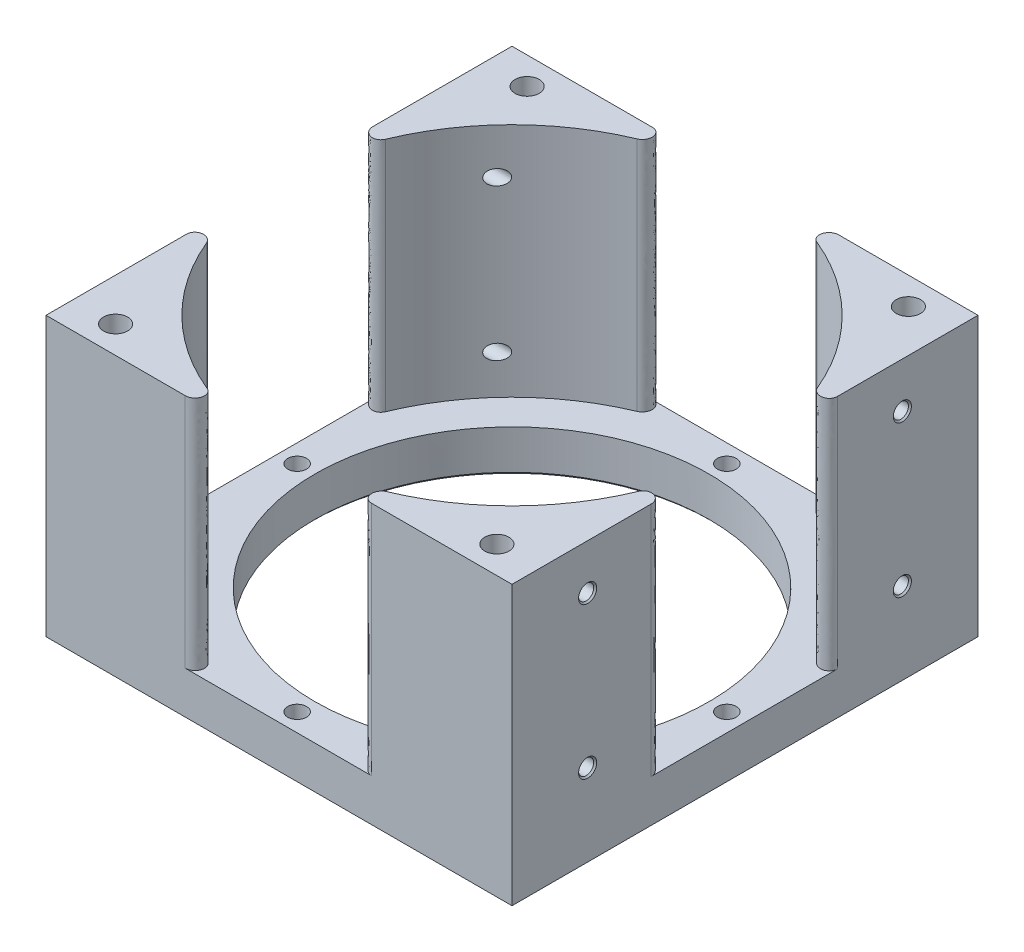
from build123d import *

# Parameters (mm, degrees)
SKIZZE1_W                                 = 77
SKIZZE1_H                                 = 77
AUFSATZ_LINEAR_AUSTRAGEN1_DEPTH           = 7
AUFSATZ_LINEAR_AUSTRAGEN2_DEPTH           = 39
SKIZZE3_R                                 = 32.575
SCHNITT_LINEAR_AUSTRAGEN1_DEPTH           = 67.973875677
F_3_1_3_1_DURCHMESSER_BOHRUNG1_D          = 3.1
F_2_5_2_5_DURCHMESSER_BOHRUNG1_AT_2_COUNT = 2
F_2_5_2_5_DURCHMESSER_BOHRUNG1_AT_2_PITCH = 52
F_2_5_2_5_DURCHMESSER_BOHRUNG1_AT_3_COUNT = 2
F_2_5_2_5_DURCHMESSER_BOHRUNG1_AT_3_PITCH = 57.697486947
F_2_5_2_5_DURCHMESSER_BOHRUNG1_AT_4_COUNT = 2
F_2_5_2_5_DURCHMESSER_BOHRUNG1_AT_4_PITCH = 25
SKIZZE8_R                                 = 2
SCHNITT_LINEAR_AUSTRAGEN2_DEPTH           = 72.277626331
FASE1_SIZE                                = 0.5


with BuildPart() as part:
    # Skizze1 → Aufsatz-Linear austragen1 (new body)
    with BuildSketch(Plane(origin=(0, 0, 0), x_dir=(1, 0, 0), z_dir=(0, 1, 0))):
        Rectangle(SKIZZE1_W, SKIZZE1_H)
    extrude(amount=AUFSATZ_LINEAR_AUSTRAGEN1_DEPTH)

    # Skizze2 → Aufsatz-Linear austragen2 (add)
    with BuildSketch(Plane(origin=(0, 7, 0), x_dir=(1, 0, 0), z_dir=(0, 1, 0))):
        with BuildLine():
            Line((2.404293035, 38.5), (38.5, 38.5))
            Line((38.5, 38.5), (38.5, 2.404293035))
            ThreePointArc((38.5, 2.404293035), (27.276644084, 27.276644084), (2.404293035, 38.5))
        make_face()
        with BuildLine():
            Line((-38.5, -38.5), (-2.404293035, -38.5))
            ThreePointArc((-2.404293035, -38.5), (-27.276644084, -27.276644084), (-38.5, -2.404293035))
            Line((-38.5, -2.404293035), (-38.5, -38.5))
        make_face()
        with BuildLine():
            Line((-38.5, 38.5), (-2.404293035, 38.5))
            ThreePointArc((-2.404293035, 38.5), (-27.276644084, 27.276644084), (-38.5, 2.404293035))
            Line((-38.5, 2.404293035), (-38.5, 38.5))
        make_face()
        with BuildLine():
            Line((38.5, -38.5), (38.5, -2.404293035))
            ThreePointArc((38.5, -2.404293035), (27.276644084, -27.276644084), (2.404293035, -38.5))
            Line((2.404293035, -38.5), (38.5, -38.5))
        make_face()
    extrude(amount=AUFSATZ_LINEAR_AUSTRAGEN2_DEPTH)

    # Verrundung1
    # a fillet whose section is not a circle: 2, 1 mm, written as the material it takes off along each edge
    with BuildSketch(Plane(origin=(38.5, 7, 2.404293035), x_dir=(0, 0, 1), z_dir=(0, 1, 0)), Plane(origin=(2.404293035, 7, -38.5), x_dir=(1, 0, 0), z_dir=(0, 1, 0)), Plane(origin=(-2.404293035, 7, 38.5), x_dir=(-1, 0, 0), z_dir=(0, 1, 0))) as verrundung1_piece_1:
        with BuildLine():
            Bezier((13.090242292, 0), (5.432703844, 0), (12.326494401, -2.848428835), weights=[1, 0.194660708, 1])
            ThreePointArc((12.326494401, -2.848428835), (6.280816774, -0.915435448), (0, 0))
            Line((0, 0), (13.090242292, 0))
        make_face()
    extrude(amount=71.725605729, mode=Mode.SUBTRACT)
    with BuildSketch(Plane(origin=(38.5, 7, -2.404293035), x_dir=(-0.22757630331638135, 0, -0.9737602508671478), z_dir=(0, 1, 0)), Plane(origin=(-38.5, 7, 2.404293035), x_dir=(0.22757630331638118, 0, 0.9737602508671478), z_dir=(0, 1, 0))) as verrundung1_piece_2:
        with BuildLine():
            Bezier((12.840965377, 0), (5.385038903, -1.258530779), (12.552254317, -2.933571825), weights=[1, 0.197104755, 1])
            Line((12.552254317, -2.933571825), (0, 0))
            ThreePointArc((0, 0), (6.420482688, -0.538070221), (12.840965377, 0))
        make_face()
    extrude(amount=71.226244361, mode=Mode.SUBTRACT)
    with BuildSketch(Plane(origin=(-2.404293035, 7, -38.5), x_dir=(-1, 0, 0), z_dir=(0, 1, 0)), Plane(origin=(2.404293035, 7, 38.5), x_dir=(1, 0, 0), z_dir=(0, 1, 0))) as verrundung1_piece_3:
        with BuildLine():
            Bezier((12.890497744, 0), (5.530148615, 0), (12.504021667, 2.922299431), weights=[1, 0.197104755, 1])
            ThreePointArc((12.504021667, 2.922299431), (6.374462865, 0.937198323), (0, 0))
            Line((0, 0), (12.890497744, 0))
        make_face()
    extrude(amount=71.226244361, mode=Mode.SUBTRACT)
    with BuildSketch(Plane(origin=(-38.5, 7, -2.404293035), x_dir=(0.22514866648068127, 0, -0.9743244213207278), z_dir=(0, 1, 0))) as verrundung1_piece_4:
        with BuildLine():
            Bezier((12.651324478, 0), (5.293216029, 1.223166026), (12.754142746, 2.947250596), weights=[1, 0.194660708, 1])
            Line((12.754142746, 2.947250596), (0, 0))
            ThreePointArc((0, 0), (6.325662239, 0.522186408), (12.651324478, 0))
        make_face()
    extrude(amount=71.725605729, mode=Mode.SUBTRACT)

    # Skizze3 → Schnitt-Linear austragen1 (cut, through all)
    with BuildSketch(Plane(origin=(0, 7, 0), x_dir=(1, 0, 0), z_dir=(0, 1, 0))):
        with Locations(Location((0, 0, 0), (0, 0, 270))):
            Circle(SKIZZE3_R)
    extrude(amount=-SCHNITT_LINEAR_AUSTRAGEN1_DEPTH, mode=Mode.SUBTRACT)

    # Ø3.1 (3.1) Durchmesser Bohrung1 (through all)
    with Locations(Plane(origin=(0, 7, 0), x_dir=(1, 0, 0), z_dir=(0, 1, 0))):
        with Locations((-35.5, 0), (0, 35.5), (35.5, 0), (0, -35.5)):
            Hole(F_3_1_3_1_DURCHMESSER_BOHRUNG1_D / 2)

    # Skizze7 → Ø2.5 (2.5) Durchmesser Bohrung1 (revolve, cut)
    with BuildSketch(Plane(origin=(38.5, 38.5, 26), x_dir=(0, 0, -1), z_dir=(0, 1, 0))):
        Polygon((0, 0), (0, 15.751075774), (1.25, 15), (1.25, 0.25), (1.5, 0), align=None)
    f_2_5_2_5_durchmesser_bohrung1 = revolve(axis=Axis((44.85, 38.5, 26), (-1, 0, 0)), mode=Mode.SUBTRACT)

    # Ø2.5 (2.5) Durchmesser Bohrung1 at 2: Ø2.5 (2.5) Durchmesser Bohrung1 ×2
    with Locations(*[(0, 0, -i * F_2_5_2_5_DURCHMESSER_BOHRUNG1_AT_2_PITCH) for i in range(1, F_2_5_2_5_DURCHMESSER_BOHRUNG1_AT_2_COUNT)]):
        add(f_2_5_2_5_durchmesser_bohrung1, mode=Mode.SUBTRACT)

    # Ø2.5 (2.5) Durchmesser Bohrung1 at 3: Ø2.5 (2.5) Durchmesser Bohrung1 ×2
    with Locations(*[Vector(0, -0.4332944348678778, -0.9012524245251862) * (i * F_2_5_2_5_DURCHMESSER_BOHRUNG1_AT_3_PITCH) for i in range(1, F_2_5_2_5_DURCHMESSER_BOHRUNG1_AT_3_COUNT)]):
        add(f_2_5_2_5_durchmesser_bohrung1, mode=Mode.SUBTRACT)

    # Ø2.5 (2.5) Durchmesser Bohrung1 at 4: Ø2.5 (2.5) Durchmesser Bohrung1 ×2
    with Locations(*[(0, -i * F_2_5_2_5_DURCHMESSER_BOHRUNG1_AT_4_PITCH, 0) for i in range(1, F_2_5_2_5_DURCHMESSER_BOHRUNG1_AT_4_COUNT)]):
        add(f_2_5_2_5_durchmesser_bohrung1, mode=Mode.SUBTRACT)

    # Spiegeln1: Ø2.5 (2.5) Durchmesser Bohrung1 across plane
    add(f_2_5_2_5_durchmesser_bohrung1.mirror(Plane(origin=(0, 0, 0), x_dir=(0, 0, 1), z_dir=(1, 0, 0))), mode=Mode.SUBTRACT)

    # Spiegeln1 copy 1 sketch → Spiegeln1 copy 1 (revolve, cut)
    with BuildSketch(Plane(origin=(-38.5, 38.5, -26), x_dir=(0, 0, -1), z_dir=(0, 1, 0))):
        Polygon((0, 0), (0, -15.751075774), (1.25, -15), (1.25, -0.25), (1.5, 0), align=None)
    revolve(axis=Axis((-44.85, 38.5, -26), (-1, 0, 0)), mode=Mode.SUBTRACT)

    # Spiegeln1 copy 2 sketch → Spiegeln1 copy 2 (revolve, cut)
    with BuildSketch(Plane(origin=(-38.5, 13.5, -26), x_dir=(0, 0, -1), z_dir=(0, 1, 0))):
        Polygon((0, 0), (0, -15.751075774), (1.25, -15), (1.25, -0.25), (1.5, 0), align=None)
    revolve(axis=Axis((-44.85, 13.5, -26), (-1, 0, 0)), mode=Mode.SUBTRACT)

    # Spiegeln1 copy 3 sketch → Spiegeln1 copy 3 (revolve, cut)
    with BuildSketch(Plane(origin=(-38.5, 13.5, 26), x_dir=(0, 0, -1), z_dir=(0, 1, 0))):
        Polygon((0, 0), (0, -15.751075774), (1.25, -15), (1.25, -0.25), (1.5, 0), align=None)
    revolve(axis=Axis((-44.85, 13.5, 26), (-1, 0, 0)), mode=Mode.SUBTRACT)

    # Skizze8 → Schnitt-Linear austragen2 (cut, through all)
    with BuildSketch(Plane(origin=(0, 46, 0), x_dir=(1, 0, 0), z_dir=(0, 1, 0))):
        with Locations(Location((-31.5, 34, 0), (0, 0, 270))):
            Circle(SKIZZE8_R)
        with Locations(Location((31.5, 34, 0), (0, 0, 90))):
            Circle(SKIZZE8_R)
        with Locations(Location((31.5, -34, 0), (0, 0, 270))):
            Circle(SKIZZE8_R)
        with Locations(Location((-31.5, -34, 0), (0, 0, 90))):
            Circle(SKIZZE8_R)
    extrude(amount=-SCHNITT_LINEAR_AUSTRAGEN2_DEPTH, mode=Mode.SUBTRACT)

    # Fase1
    fase1_edges = [part.edges().sort_by_distance(p)[0] for p in [
        (0, 0, -32.575),
    ]]
    chamfer(fase1_edges, length=FASE1_SIZE)


solid = part.part
